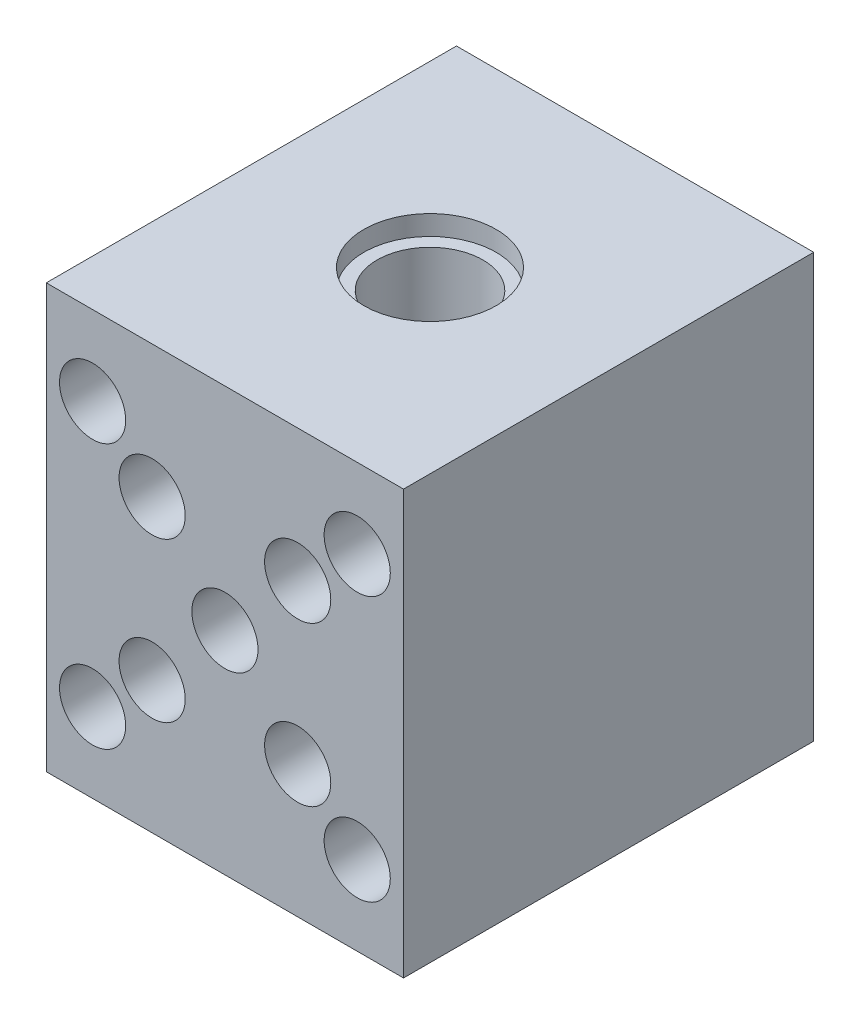
from build123d import *

# Parameters (mm, degrees)
SCHIZZO1_W                   = 27
SCHIZZO1_H                   = 32
ESTRUSIONE_ESTRUSIONE1_DEPTH = 31
SCHIZZO2_R                   = 1.5
TAGLIO_ESTRUSIONE1_DEPTH     = 38.406550229
SCHIZZO3_R                   = 4
TAGLIO_ESTRUSIONE2_DEPTH     = 47.553732396
SCHIZZO4_R                   = 5
TAGLIO_ESTRUSIONE5_DEPTH     = 1.5
TAGLIO_ESTRUSIONE6_START     = -1.5
SCHIZZO5_R                   = 5
TAGLIO_ESTRUSIONE6_DEPTH     = 1.5
SCHIZZO6_R                   = 2.5
TAGLIO_ESTRUSIONE7_DEPTH     = 15
SCHIZZO7_R                   = 2.5
TAGLIO_ESTRUSIONE8_DEPTH     = 10


with BuildPart() as part:
    # Schizzo1 → Estrusione-Estrusione1 (new body)
    with BuildSketch(Plane.XY):
        Rectangle(SCHIZZO1_W, SCHIZZO1_H)
    extrude(amount=ESTRUSIONE_ESTRUSIONE1_DEPTH)

    # Schizzo2 → Taglio-Estrusione1 (cut, through all)
    with BuildSketch(Plane(origin=(0, 0, 0), x_dir=(-1, 0, 0), z_dir=(0, 0, -1))):
        with Locations((-10, 10)):
            Circle(SCHIZZO2_R)
        with Locations((10, 10)):
            Circle(SCHIZZO2_R)
        with Locations((10, -10)):
            Circle(SCHIZZO2_R)
        with Locations((-10, -10)):
            Circle(SCHIZZO2_R)
    extrude(amount=-TAGLIO_ESTRUSIONE1_DEPTH, mode=Mode.SUBTRACT)

    # Schizzo3 → Taglio-Estrusione2 (cut, through all)
    with BuildSketch(Plane(origin=(0, 16, 0), x_dir=(1, 0, 0), z_dir=(0, 1, 0))):
        with Locations((0, -15.5)):
            Circle(SCHIZZO3_R)
    extrude(amount=-TAGLIO_ESTRUSIONE2_DEPTH, mode=Mode.SUBTRACT)

    # Schizzo4 → Taglio-Estrusione5 (cut)
    with BuildSketch(Plane(origin=(0, 16, 0), x_dir=(1, 0, 0), z_dir=(0, 1, 0))):
        with Locations((0, -15.5)):
            Circle(SCHIZZO4_R)
    extrude(amount=-TAGLIO_ESTRUSIONE5_DEPTH, mode=Mode.SUBTRACT)

    # Schizzo5 → Taglio-Estrusione6 (cut)
    with BuildSketch(Plane.XZ.offset(16).offset(TAGLIO_ESTRUSIONE6_START)):
        with Locations((0, 15.5)):
            Circle(SCHIZZO5_R)
    extrude(amount=TAGLIO_ESTRUSIONE6_DEPTH, mode=Mode.SUBTRACT)

    # Schizzo6 → Taglio-Estrusione7 (cut)
    with BuildSketch(Plane.XY.offset(31)):
        with Locations((-10, 10)):
            Circle(SCHIZZO6_R)
        with Locations((10, 10)):
            Circle(SCHIZZO6_R)
        with Locations((10, -10)):
            Circle(SCHIZZO6_R)
        with Locations((-10, -10)):
            Circle(SCHIZZO6_R)
    extrude(amount=-TAGLIO_ESTRUSIONE7_DEPTH, mode=Mode.SUBTRACT)

    # Schizzo7 → Taglio-Estrusione8 (cut)
    with BuildSketch(Plane.XY.offset(31)):
        with Locations((-5.5, 6)):
            Circle(SCHIZZO7_R)
        with Locations((5.5, 6)):
            Circle(SCHIZZO7_R)
        Circle(SCHIZZO7_R)
        with Locations((5.5, -6)):
            Circle(SCHIZZO7_R)
        with Locations((-5.5, -6)):
            Circle(SCHIZZO7_R)
    extrude(amount=-TAGLIO_ESTRUSIONE8_DEPTH, mode=Mode.SUBTRACT)


solid = part.part
